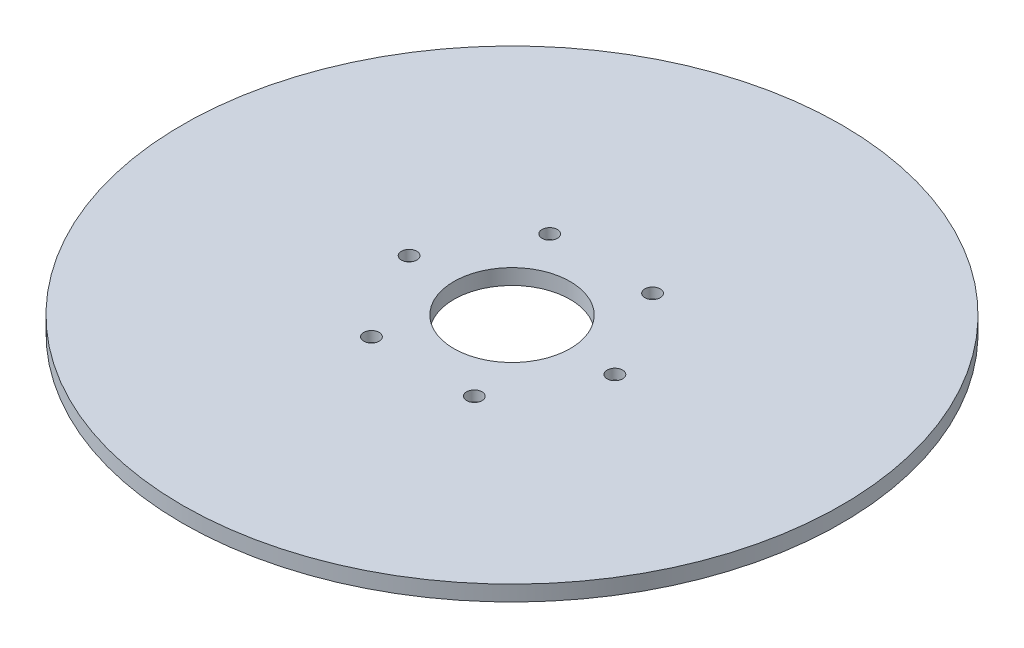
from build123d import *

# Parameters (mm, degrees)
SKETCH1_R           = 85
BOSS_EXTRUDE1_DEPTH = 4
SKETCH2_R           = 15
CUT_EXTRUDE1_DEPTH  = 121.274685616
SKETCH3_R           = 1.987487824
CUT_EXTRUDE2_DEPTH  = 2.677604017
CIRPATTERN1_COUNT   = 6


with BuildPart() as part:
    # Sketch1 → Boss-Extrude1 (new body)
    with BuildSketch(Plane(origin=(0, 0, 0), x_dir=(1, 0, 0), z_dir=(0, 1, 0))):
        Circle(SKETCH1_R)
    extrude(amount=BOSS_EXTRUDE1_DEPTH)

    # Sketch2 → Cut-Extrude1 (cut, through all)
    with BuildSketch(Plane(origin=(0, 0, 0), x_dir=(1, 0, 0), z_dir=(0, 1, 0))):
        Circle(SKETCH2_R)
    extrude(amount=CUT_EXTRUDE1_DEPTH, mode=Mode.SUBTRACT)

    # Sketch3 → Cut-Extrude2 (cut)
    with BuildSketch(Plane(origin=(0, 4, 0), x_dir=(1, 0, 0), z_dir=(0, 1, 0))):
        with Locations((-26.539929768, 0)):
            Circle(SKETCH3_R)
    cut_extrude2 = extrude(amount=-CUT_EXTRUDE2_DEPTH, mode=Mode.SUBTRACT)

    # CirPattern1: Cut-Extrude2 ×6 about axis
    cirpattern1_axis = Axis((0, 0, 0), (0, 1, 0))
    for i in range(1, CIRPATTERN1_COUNT):
        add(cut_extrude2.rotate(cirpattern1_axis, i * 360 / CIRPATTERN1_COUNT), mode=Mode.SUBTRACT)


solid = part.part
